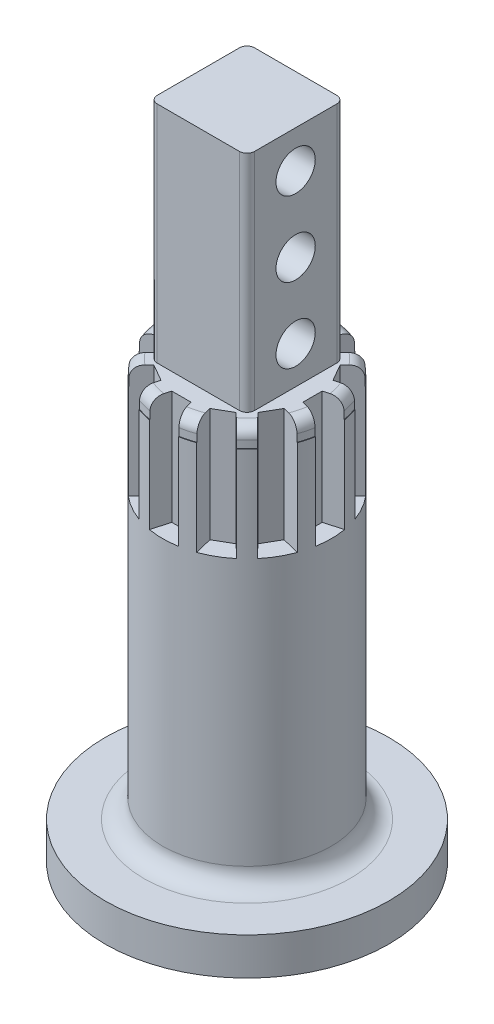
from build123d import *

# Parameters (mm, degrees)
SKETCH1_R           = 37.9
BOSS_EXTRUDE1_DEPTH = 10
SKETCH2_R           = 22.53
BOSS_EXTRUDE2_DEPTH = 101.6
FILLET1_R           = 5
CUT_EXTRUDE3_START  = -25.4
CUT_EXTRUDE3_DEPTH  = 30.4
CIRPATTERN1_COUNT   = 12
SKETCH5_R           = 22.4
BOSS_EXTRUDE3_DEPTH = 5
SKETCH6_W           = 26
SKETCH6_H           = 26
BOSS_EXTRUDE4_DEPTH = 60
SKETCH7_R           = 5.25
CUT_EXTRUDE2_DEPTH  = 46
CUT_EXTRUDE4_DEPTH  = 25.4
CIRPATTERN2_COUNT   = 12
FILLET3_R           = 3
FILLET4_R           = 2


with BuildPart() as part:
    # Sketch1 → Boss-Extrude1 (new body)
    with BuildSketch(Plane(origin=(0, 0, 0), x_dir=(1, 0, 0), z_dir=(0, 1, 0))):
        Circle(SKETCH1_R)
    extrude(amount=BOSS_EXTRUDE1_DEPTH)

    # Sketch2 → Boss-Extrude2 (add)
    with BuildSketch(Plane(origin=(0, 10, 0), x_dir=(1, 0, 0), z_dir=(0, 1, 0))):
        Circle(SKETCH2_R)
    extrude(amount=BOSS_EXTRUDE2_DEPTH)

    # Fillet1
    fillet1_edges = [part.edges().sort_by_distance(p)[0] for p in [
        (-22.53, 10, 0),
    ]]
    fillet(fillet1_edges, radius=FILLET1_R)

    # Sketch8 → Cut-Extrude3 (cut)
    with BuildSketch(Plane(origin=(0, 111.6, 0), x_dir=(1, 0, 0), z_dir=(0, 1, 0)).offset(CUT_EXTRUDE3_START)):
        Polygon((0, 22.53), (-4, 22.53), (-2.566217961, 17.53), (2.566217961, 17.53), (4, 22.53), align=None)
    cut_extrude3 = extrude(amount=CUT_EXTRUDE3_DEPTH, mode=Mode.SUBTRACT)

    # CirPattern1: Cut-Extrude3 ×12 about axis
    cirpattern1_axis = Axis((0, 111.6, 0), (0, 1, 0))
    for i in range(1, CIRPATTERN1_COUNT):
        add(cut_extrude3.rotate(cirpattern1_axis, i * 360 / CIRPATTERN1_COUNT), mode=Mode.SUBTRACT)

    # Sketch5 → Boss-Extrude3 (add)
    with BuildSketch(Plane(origin=(0, 111.6, 0), x_dir=(1, 0, 0), z_dir=(0, 1, 0))):
        Circle(SKETCH5_R)
    extrude(amount=BOSS_EXTRUDE3_DEPTH)

    # Sketch6 → Boss-Extrude4 (add)
    with BuildSketch(Plane(origin=(0, 116.6, 0), x_dir=(1, 0, 0), z_dir=(0, 1, 0))):
        Rectangle(SKETCH6_W, SKETCH6_H)
    extrude(amount=BOSS_EXTRUDE4_DEPTH)

    # Sketch7 → Cut-Extrude2 (cut)
    with BuildSketch(Plane(origin=(13, 0, 0), x_dir=(0, 0, -1), z_dir=(1, 0, 0))):
        with Locations((0, 166.6)):
            Circle(SKETCH7_R)
        with Locations((0, 126.6)):
            Circle(SKETCH7_R)
        with Locations((0, 146.6)):
            Circle(SKETCH7_R)
    extrude(amount=-CUT_EXTRUDE2_DEPTH, mode=Mode.SUBTRACT)

    # Sketch8<2> → Cut-Extrude4 (cut)
    with BuildSketch(Plane(origin=(0, 111.6, 0), x_dir=(1, 0, 0), z_dir=(0, 1, 0))):
        Polygon((0, 22.53), (-4, 22.53), (-2.566217961, 17.53), (2.566217961, 17.53), (4, 22.53), align=None)
    cut_extrude4 = extrude(amount=CUT_EXTRUDE4_DEPTH, mode=Mode.SUBTRACT)

    # CirPattern2: Cut-Extrude4 ×12 about axis
    cirpattern2_axis = Axis((0, 116.6, 0), (0, 1, 0))
    for i in range(1, CIRPATTERN2_COUNT):
        add(cut_extrude4.rotate(cirpattern2_axis, i * 360 / CIRPATTERN2_COUNT), mode=Mode.SUBTRACT)

    # Fillet3
    fillet3_edges = [part.edges().sort_by_distance(p)[0] for p in [
        (-5.79754661, 116.6, -21.636738509),
        (-21.636738509, 116.6, -5.79754661),
        (-21.636738509, 116.6, 5.79754661),
        (-15.839191899, 116.6, 15.839191899),
        (-5.79754661, 116.6, 21.636738509),
        (5.79754661, 116.6, 21.636738509),
        (15.839191899, 116.6, 15.839191899),
        (21.636738509, 116.6, 5.79754661),
        (21.636738509, 116.6, -5.79754661),
        (15.839191899, 116.6, -15.839191899),
        (5.79754661, 116.6, -21.636738509),
        (-15.839191899, 116.6, -15.839191899),
    ]]
    fillet(fillet3_edges, radius=FILLET3_R)

    # Fillet4
    fillet4_edges = [part.edges().sort_by_distance(p)[0] for p in [
        (-13, 146.6, -13),
        (13, 146.6, -13),
        (13, 146.6, 13),
        (-13, 146.6, 13),
    ]]
    fillet(fillet4_edges, radius=FILLET4_R)


solid = part.part
